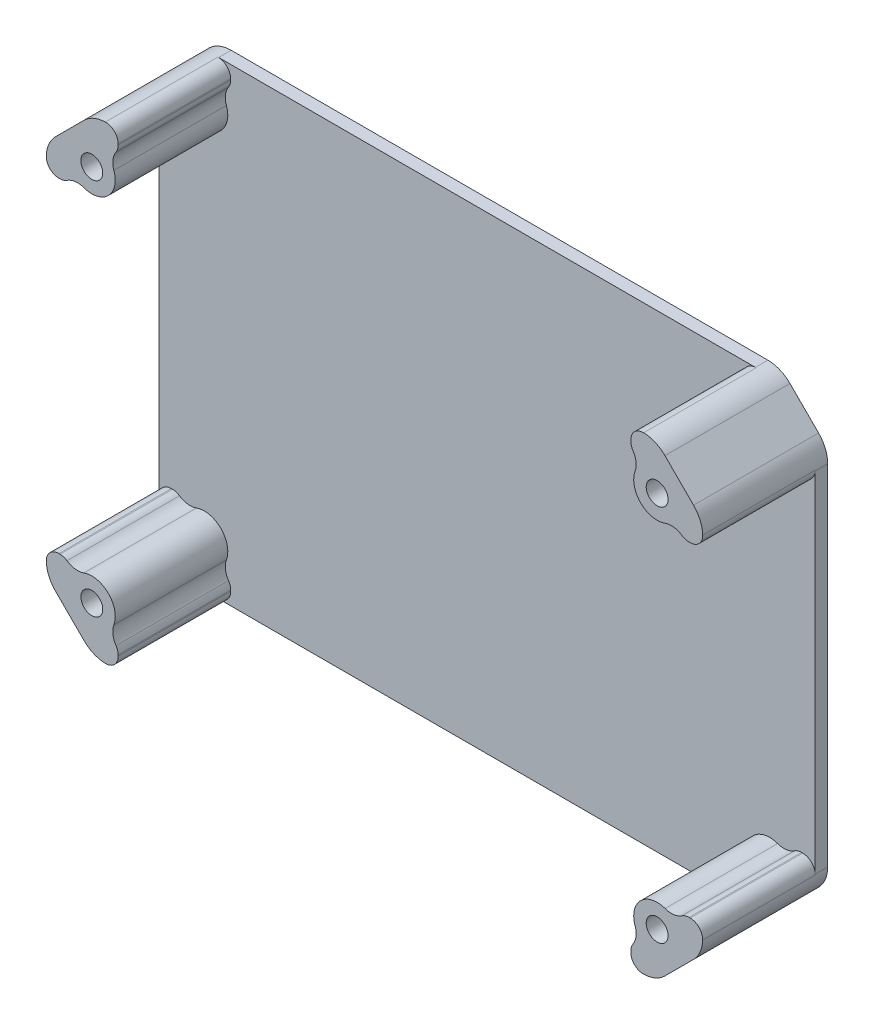
from build123d import *

# Parameters (mm, degrees)
EXTRUDE_1_DEPTH     = 20
SKETCH_2_R          = 1.75
CUT_EXTRUDE_1_DEPTH = 34
SHELL_1_T           = -2
FILLET_1_R          = 10
FILLET_2_R          = 3
FILLET_3_R          = 5
SKETCH_4_W          = 82
SKETCH_4_H          = 126.745531776
CUT_EXTRUDE_2_DEPTH = 18
FILLET_4_R          = 2
CUT_EXTRUDE_START   = -18
SKETCH_5_W          = 173.89587329
SKETCH_5_H          = 52
CUT_EXTRUDE_3_DEPTH = 18
FILLET_5_R          = 2


with BuildPart() as part:
    # Эскиз1 → Бобышка-Вытянуть1 (new body)
    with BuildSketch(Plane.XY):
        Polygon((-52.5, 30), (-45, 37.5), (45, 37.5), (52.5, 30), (52.5, -30), (45, -37.5), (-45, -37.5), (-52.5, -30), align=None)
    extrude(amount=EXTRUDE_1_DEPTH)

    # Эскиз2 → Вырез-Вытянуть1 (cut)
    with BuildSketch(Plane.XY.offset(20)):
        with Locations((-45.214466094, 30.214466094)):
            Circle(SKETCH_2_R)
        with Locations(Location((45.214466094, 30.214466094, 0), (0, 0, 180))):
            Circle(SKETCH_2_R)
        with Locations((45.214466094, -30.214466094)):
            Circle(SKETCH_2_R)
        with Locations(Location((-45.214466094, -30.214466094, 0), (0, 0, 180))):
            Circle(SKETCH_2_R)
    extrude(amount=-CUT_EXTRUDE_1_DEPTH, mode=Mode.SUBTRACT)

    # Оболочка1
    shell_1_openings = [part.faces().sort_by_distance(p)[0] for p in [
        (0, 0, 20),
    ]]
    offset(amount=SHELL_1_T, openings=shell_1_openings, kind=Kind.INTERSECTION)

    # Скругление1
    # the kernel refuses this fillet: 10 mm, written as the material it adds along each edge
    with BuildSketch(Plane(origin=(-45.74479618, -33.926776695, 2), x_dir=(0.7071067811865442, -0.7071067811865507, 0), z_dir=(0, 0, 1)), Plane(origin=(48.926776695, -30.74479618, 2), x_dir=(0.7071067811865482, 0.7071067811865467, 0), z_dir=(0, 0, 1)), Plane(origin=(45.74479618, 33.926776695, 2), x_dir=(-0.707106781186546, 0.7071067811865492, 0), z_dir=(0, 0, 1)), Plane(origin=(-48.926776695, 30.74479618, 2), x_dir=(-0.7071067811865508, -0.7071067811865444, 0), z_dir=(0, 0, 1))) as fillet_1_piece_1:
        with BuildLine():
            CenterArc((11.477032042, 3.794412555), FILLET_1_R, 183.312134334, 18.986942704)
            Line((1.493736012, 3.21665797), (1.294070091, 3.205102878))
            ThreePointArc((1.294070091, 3.205102878), (0.969771845, 1.504817982), (-0.12, 0.16))
            Line((-0.12, 0.16), (0, -0.2))
            ThreePointArc((0, -0.2), (1.112436867, -0.2), (2.039830568, -0.075888251))
            Line((2.039830568, -0.075888251), (2.224873734, 0))
        make_face()
    extrude(amount=18)
    with BuildSketch(Plane(origin=(-48.926776695, -30.74479618, 2), x_dir=(0.34351243985929386, 0.9391481265816991, 0), z_dir=(0, 0, 1)), Plane(origin=(45.74479618, -33.926776695, 2), x_dir=(-0.9391481265817004, 0.34351243985929, 0), z_dir=(0, 0, 1)), Plane(origin=(48.926776695, 30.74479618, 2), x_dir=(-0.3435124398592874, -0.9391481265817014, 0), z_dir=(0, 0, 1)), Plane(origin=(-45.74479618, 33.926776695, 2), x_dir=(0.9391481265817011, -0.34351243985928803, 0), z_dir=(0, 0, 1))) as fillet_1_piece_2:
        with BuildLine():
            CenterArc((8.275322434, 8.811292173), FILLET_1_R, 222.791938952, 18.986942704)
            Line((0.937067943, 2.017911495), (0.790302854, 1.882043882))
            ThreePointArc((0.790302854, 1.882043882), (0.287138375, 1.093191354), (-0.181395597, 0.084235607))
            Line((-0.181395597, 0.084235607), (0.094575114, -0.176225843))
            ThreePointArc((0.094575114, -0.176225843), (1.773283379, 0.245765435), (3.451991644, -0.176225843))
            Line((3.451991644, -0.176225843), (3.546566758, 0))
        make_face()
    extrude(amount=18)

    # Скругление2
    fillet_2_edges = [part.edges().sort_by_distance(p)[0] for p in [
        (-50.5, 29.171572875, 11),
        (-44.171572875, 35.5, 11),
        (-44.171572875, -35.5, 11),
        (-50.5, -29.171572875, 11),
        (44.171572875, -35.5, 11),
        (50.5, -29.171572875, 11),
        (50.5, 29.171572875, 11),
        (44.171572875, 35.5, 11),
    ]]
    fillet(fillet_2_edges, radius=FILLET_2_R)

    # Скругление3
    fillet_3_edges = [part.edges().sort_by_distance(p)[0] for p in [
        (45, 37.5, 10),
        (52.5, 30, 10),
        (52.5, -30, 10),
        (45, -37.5, 10),
        (-45, -37.5, 10),
        (-52.5, -30, 10),
        (-52.5, 30, 10),
        (-45, 37.5, 10),
    ]]
    fillet(fillet_3_edges, radius=FILLET_3_R)

    # Эскиз4 → Вырез-Вытянуть2 (cut)
    with BuildSketch(Plane.XY.offset(20)):
        Rectangle(SKETCH_4_W, SKETCH_4_H)
    extrude(amount=-CUT_EXTRUDE_2_DEPTH, mode=Mode.SUBTRACT)

    # Скругление4
    # the kernel refuses this fillet: 2 mm, written as the material it takes off along each edge
    with BuildSketch(Plane(origin=(41, -34.605706623, 2), x_dir=(0, -1, 0), z_dir=(0, 0, 1)), Plane(origin=(41, 34.605706623, 21.756559814), x_dir=(0, 1, 0), z_dir=(0, 0, -1))) as fillet_4_piece_1:
        with BuildLine():
            CenterArc((0.702623926, 2), FILLET_4_R, 235.828901177, 34.171098823)
            ThreePointArc((-0.420708294, 0.345272009), (-0.20250821, 0.18219615), (0, 0))
            Line((0, 0), (0.702623926, 0))
        make_face()
    extrude(amount=19.756559814, mode=Mode.SUBTRACT)
    with BuildSketch(Plane(origin=(41, -37.5, 25.118447555), x_dir=(0.9999997651545144, 0.0006853400003404547, 0), z_dir=(0, 0, -1)), Plane(origin=(-41, -37.5, 2), x_dir=(-0.9999997651545144, 0.0006853400003439418, 0), z_dir=(0, 0, 1)), Plane(origin=(41, 37.5, 2), x_dir=(0.9999997651545144, -0.0006853400003439394, 0), z_dir=(0, 0, 1))) as fillet_4_piece_2:
        with BuildLine():
            CenterArc((2.001370787, -1.999470741), FILLET_4_R, 88.681844886, 91.357422207)
            Line((0.001371257, -2.000841421), (-0.198628696, -2.000978489))
            Line((-0.198628696, -2.000978489), (-0.199999953, -0.000137068))
            Line((-0.199999953, -0.000137068), (-0.000137068, 0.199999953))
            ThreePointArc((-0.000137068, 0.199999953), (1.928794667, 0.201321927), (2.051979846, 0.199947074))
            Line((2.051979846, 0.199947074), (2.047379022, 0))
        make_face()
    extrude(amount=23.118447555, mode=Mode.SUBTRACT)
    with BuildSketch(Plane(origin=(-41, -34.605706623, 2), x_dir=(0, -1, 0), z_dir=(0, 0, 1))) as fillet_4_piece_3:
        with BuildLine():
            CenterArc((0.702623926, -2), FILLET_4_R, 90, 34.171098823)
            ThreePointArc((-0.420708294, -0.345272009), (-0.20250821, -0.18219615), (0, 0))
            Line((0, 0), (0.702623926, 0))
        make_face()
    extrude(amount=19.756559814, mode=Mode.SUBTRACT)
    with BuildSketch(Plane(origin=(-41, 34.605706623, 21.756559814), x_dir=(-0.6343994710236062, -0.7730053758965514, 0), z_dir=(0, 0, -1))) as fillet_4_piece_4:
        with BuildLine():
            CenterArc((0.72566687, 1.991754999), FILLET_4_R, 230.624541426, 34.171098823)
            Line((-0.543132072, 0.445744247), (0, 0))
            ThreePointArc((0, 0), (0.272125076, 0.012367502), (0.544250153, 0))
        make_face()
    extrude(amount=19.756559814, mode=Mode.SUBTRACT)
    with BuildSketch(Plane(origin=(-41, 37.5, 25.118447555), x_dir=(0, -1, 0), z_dir=(0, 0, -1))) as fillet_4_piece_5:
        with BuildLine():
            CenterArc((2.00084189, 2), FILLET_4_R, 178.642577793, 91.357422207)
            Line((0.001403151, 2.047378541), (-0.198540723, 2.052116395))
            ThreePointArc((-0.198540723, 2.052116395), (-0.2, 1.928932188), (-0.2, 0))
            Line((-0.2, 0), (0, -0.2))
            Line((0, -0.2), (2.00084189, -0.2))
            Line((2.00084189, -0.2), (2.00084189, 0))
        make_face()
    extrude(amount=23.118447555, mode=Mode.SUBTRACT)

    # Эскиз5 → Вырез-Вытянуть3 (cut)
    with BuildSketch(Plane.XY.offset(20).offset(CUT_EXTRUDE_START)):
        Rectangle(SKETCH_5_W, SKETCH_5_H)
    extrude(amount=CUT_EXTRUDE_3_DEPTH, mode=Mode.SUBTRACT)

    # Скругление5
    # the kernel refuses this fillet: 2 mm, written as the material it takes off along each edge
    with BuildSketch(Plane(origin=(49.605706623, -26, 21.756559814), x_dir=(1, 0, 0), z_dir=(0, 0, -1)), Plane(origin=(-49.605706623, -26, 2), x_dir=(-1, 0, 0), z_dir=(0, 0, 1))) as fillet_5_piece_1:
        with BuildLine():
            CenterArc((0.702623926, 2), FILLET_5_R, 235.828901177, 34.171098823)
            ThreePointArc((-0.420708294, 0.345272009), (-0.20250821, 0.18219615), (0, 0))
            Line((0, 0), (0.702623926, 0))
        make_face()
    extrude(amount=19.756559814, mode=Mode.SUBTRACT)
    with BuildSketch(Plane(origin=(52.5, -26, 25.118447555), x_dir=(-0.0006853400003439216, -0.9999997651545144, 0), z_dir=(0, 0, -1)), Plane(origin=(52.5, 26, 2), x_dir=(-0.0006853400003439287, 0.9999997651545144, 0), z_dir=(0, 0, 1)), Plane(origin=(-52.5, -26, 2), x_dir=(0.0006853400003439322, -0.9999997651545144, 0), z_dir=(0, 0, 1)), Plane(origin=(-52.5, 26, 25.118447555), x_dir=(0.0006853400003439264, 0.9999997651545144, 0), z_dir=(0, 0, -1))) as fillet_5_piece_2:
        with BuildLine():
            CenterArc((2.001370787, 1.999470741), FILLET_5_R, 179.960732907, 91.357422207)
            Line((0.001371257, 2.000841421), (-0.198628696, 2.000978489))
            Line((-0.198628696, 2.000978489), (-0.199999953, 0.000137068))
            Line((-0.199999953, 0.000137068), (-0.000137068, -0.199999953))
            ThreePointArc((-0.000137068, -0.199999953), (1.928794667, -0.201321927), (2.051979846, -0.199947074))
            Line((2.051979846, -0.199947074), (2.047379022, 0))
        make_face()
    extrude(amount=23.118447555, mode=Mode.SUBTRACT)
    with BuildSketch(Plane(origin=(49.605706623, 26, 21.756559814), x_dir=(-0.7730053758965525, 0.6343994710236047, 1.8308445150644594e-15), z_dir=(0, 0, -1))) as fillet_5_piece_3:
        with BuildLine():
            CenterArc((0.72566687, 1.991754999), FILLET_5_R, 230.624541426, 34.171098823)
            Line((-0.543132072, 0.445744247), (0, 0))
            ThreePointArc((0, 0), (0.272125076, 0.012367502), (0.544250153, 0))
        make_face()
    extrude(amount=19.756559814, mode=Mode.SUBTRACT)
    with BuildSketch(Plane(origin=(-49.605706623, 26, 2), x_dir=(-1, 0, 0), z_dir=(0, 0, 1))) as fillet_5_piece_4:
        with BuildLine():
            CenterArc((0.702623926, -2), FILLET_5_R, 90, 34.171098823)
            ThreePointArc((-0.420708294, -0.345272009), (-0.20250821, -0.18219615), (0, 0))
            Line((0, 0), (0.702623926, 0))
        make_face()
    extrude(amount=19.756559814, mode=Mode.SUBTRACT)


solid = part.part
